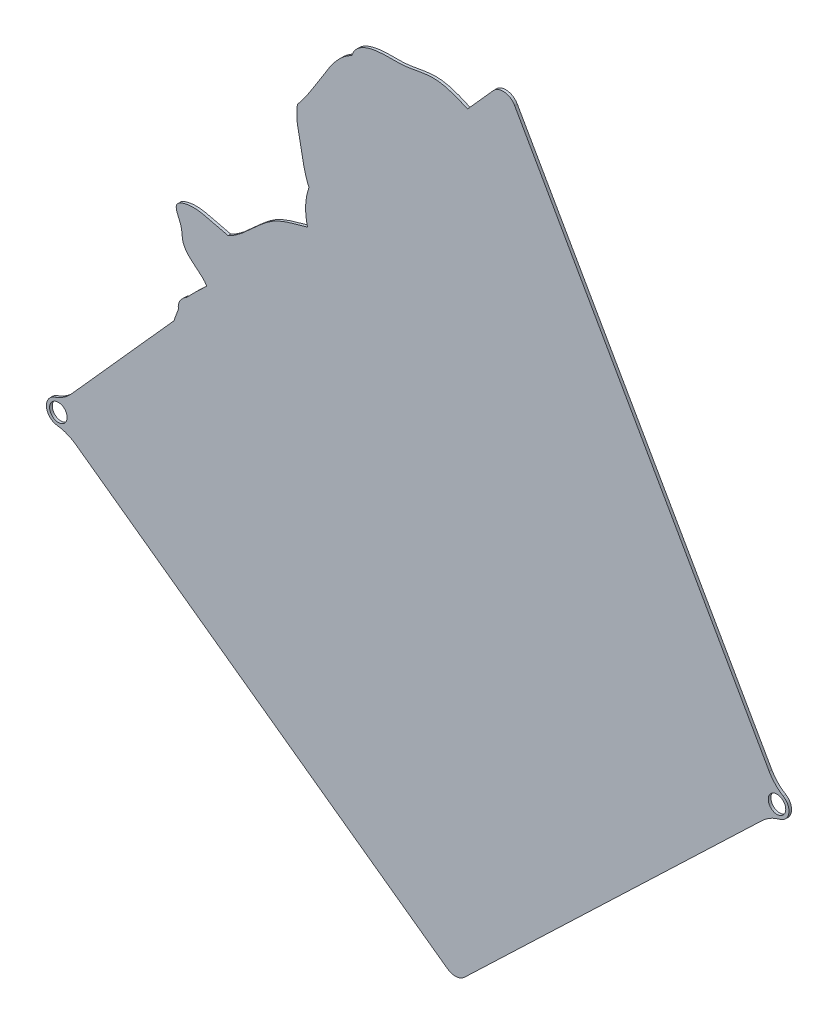
from build123d import *

# Parameters (mm, degrees)
BOSS_EXTRUDE1_START = -3
SKETCH1_R           = 3.3
BOSS_EXTRUDE1_DEPTH = 1


with BuildPart() as part:
    # Sketch1 → Boss-Extrude1 (new body)
    with BuildSketch(Plane.XY.offset(BOSS_EXTRUDE1_START)):
        with BuildLine():
            Line((175.530545653, 297.078241002), (165.847660098, 286.247140349))
            add(Edge.make_bspline(
                [(165.847660098, 286.247140349), (161.958951275, 288.053215105), (153.7541863, 291.385632032), (142.949710049, 287.922349017), (132.08866755, 288.696875058), (123.730011038, 286.762274271), (122.229813512, 281.878394702)],
                knots=[0, 0, 0, 0, 0.282569956, 0.534959137, 0.697744118, 1, 1, 1, 1], degree=3))
            add(Edge.make_bspline(
                [(122.229813512, 281.878394702), (118.058976155, 279.823016138), (111.235657544, 270.739838071), (106.106560937, 260.813884877), (101.703831056, 255.636584821)],
                knots=[0, 0, 0, 0, 0.398895915, 1, 1, 1, 1], degree=3))
            add(Edge.make_bspline(
                [(101.703831056, 255.636584821), (100.938919323, 251.235797266), (103.183355148, 242.927772517), (104.33056652, 234.543938083), (106.075647572, 230.779395719)],
                knots=[0, 0, 0, 0, 0.517213565, 1, 1, 1, 1], degree=3))
            add(Edge.make_bspline(
                [(106.075647572, 230.779395719), (103.798133299, 224.247937083), (105.543362439, 217.548369999)],
                knots=[0, 0, 0, 1, 1, 1], degree=2))
            add(Edge.make_bspline(
                [(105.543362439, 217.548369999), (101.478949421, 216.275176704), (89.438329667, 214.004143017), (82.364872068, 202.984357934), (75.608431069, 199.787338704)],
                knots=[0, 0, 0, 0, 0.364395461, 1, 1, 1, 1], degree=3))
            add(Edge.make_bspline(
                [(75.608431069, 199.787338704), (72.965008377, 200.448410696), (68.130105896, 201.670017191), (62.019757504, 202.966820343), (54.835011624, 201.049857451), (56.921255323, 196.431484587), (58.321643082, 193.17869111), (58.082321369, 189.161546227), (61.757389476, 184.075704484), (65.851558074, 182.053410846), (67.551159033, 179.262120633)],
                knots=[0, 0, 0, 0, 0.185122606, 0.320265005, 0.454108381, 0.537288926, 0.599177691, 0.700070158, 0.790196975, 1, 1, 1, 1], degree=3))
            add(Edge.make_bspline(
                [(67.551159033, 179.262120633), (63.651335521, 175.669295098), (59.980616164, 171.840128471)],
                knots=[0, 0, 0, 1, 1, 1], degree=2))
            add(Edge.make_bspline(
                [(59.980616164, 171.840128471), (58.13524604, 170.76965569), (56.3909212, 168.715252622), (56.887266336, 166.42033094)],
                knots=[0, 0, 0, 0, 1, 1, 1, 1], degree=3))
            ThreePointArc((56.887266336, 166.42033094), (56.001787201, 164.093208994), (55.156159125, 161.751311683))
            Line((55.156159125, 161.751311683), (16.490969335, 118.53562592))
            ThreePointArc((16.490969335, 118.53562592), (13.594458931, 116.03119733), (10.158239499, 114.341720756))
            ThreePointArc((10.158239499, 114.341720756), (7.138291038, 109.59789587), (11.104930852, 105.61170322))
            ThreePointArc((11.104930852, 105.61170322), (14.823431664, 104.698091272), (18.189463296, 102.87277866))
            Line((18.189463296, 102.87277866), (158.308378587, 1.805164583))
            ThreePointArc((158.308378587, 1.805164583), (161.577939242, 0.872224158), (164.688165503, 2.245867969))
            Line((164.688165503, 2.245867969), (276.957680669, 109.555734945))
            ThreePointArc((276.957680669, 109.555734945), (280.040760403, 111.826539744), (283.598320347, 113.242767948))
            ThreePointArc((283.598320347, 113.242767948), (286.933122885, 116.94588976), (284.808210365, 121.45352394))
            ThreePointArc((284.808210365, 121.45352394), (281.810364375, 123.835719251), (279.51333018, 126.899306851))
            Line((279.51333018, 126.899306851), (183.60866827, 296.210136052))
            ThreePointArc((183.60866827, 296.210136052), (179.792379546, 298.717191637), (175.530545653, 297.078241002))
        make_face()
        with Locations((11.612063393, 110.083035973)):
            Circle(SKETCH1_R, mode=Mode.SUBTRACT)
        with Locations((282.4811963, 117.601900186)):
            Circle(SKETCH1_R, mode=Mode.SUBTRACT)
    extrude(amount=-BOSS_EXTRUDE1_DEPTH)


solid = part.part
